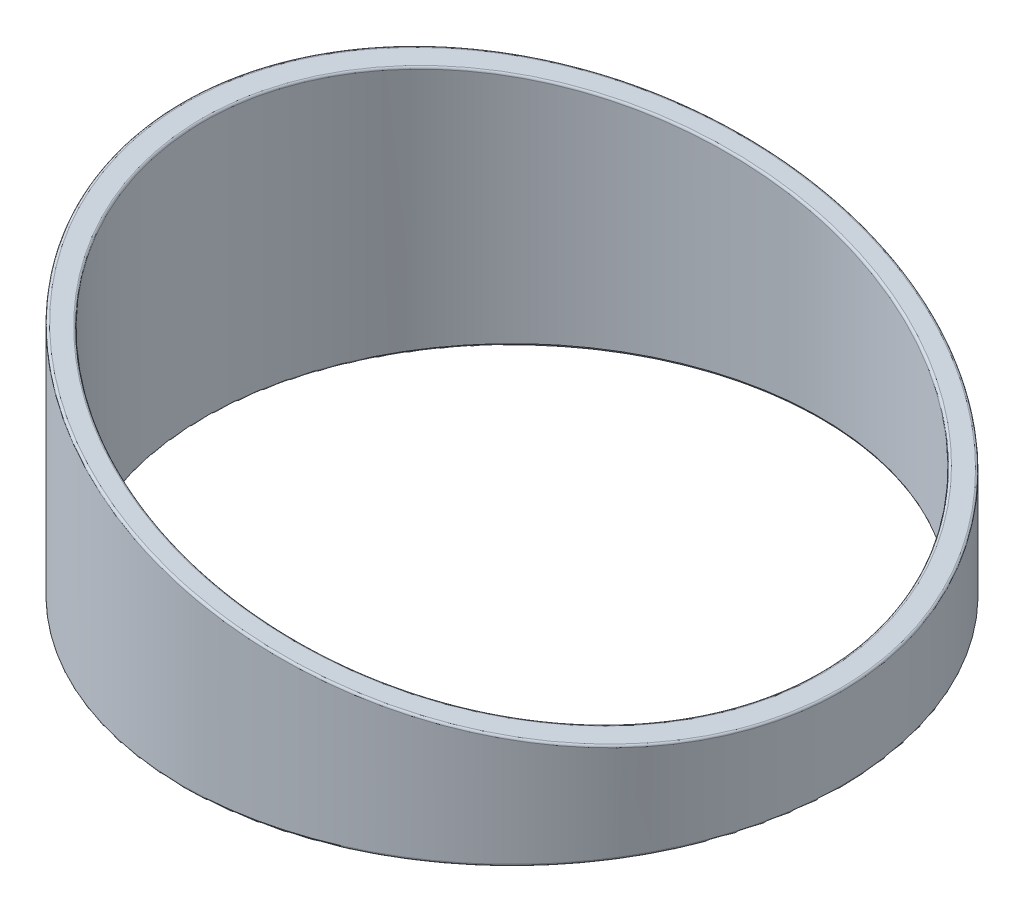
from build123d import *

# Parameters (mm, degrees)
SKETCH1_R               = 31
SKETCH1_R_2             = 29
BOSS_EXTRUDE1_DEPTH     = 25
CUT_EXTRUDE1_DEPTH      = 51.467811524
CUT_EXTRUDE1_DEPTH_BACK = 51.467811524
FILLET1_R               = 0.2


with BuildPart() as part:
    # Sketch1 → Boss-Extrude1 (new body)
    with BuildSketch(Plane(origin=(0, 0, 0), x_dir=(1, 0, 0), z_dir=(0, 1, 0))):
        Circle(SKETCH1_R)
        Circle(SKETCH1_R_2, mode=Mode.SUBTRACT)
    extrude(amount=BOSS_EXTRUDE1_DEPTH)

    # Sketch2 → Cut-Extrude1 (cut, two sides: drawn at the far end of the back side and taken through both)
    with BuildSketch(Plane.XY.offset(-CUT_EXTRUDE1_DEPTH_BACK)):
        Polygon((-31, 25), (31, 8), (31, 25), align=None)
    extrude(amount=CUT_EXTRUDE1_DEPTH + CUT_EXTRUDE1_DEPTH_BACK, mode=Mode.SUBTRACT)

    # Fillet1
    fillet1_edges = [part.edges().sort_by_distance(p)[0] for p in [
        (2e-09, 16.5, 31),
        (-29, 24.451612903, 2.1945e-05),
        (-29, 0, 0),
        (-31, 0, 0),
    ]]
    fillet(fillet1_edges, radius=FILLET1_R)


solid = part.part
